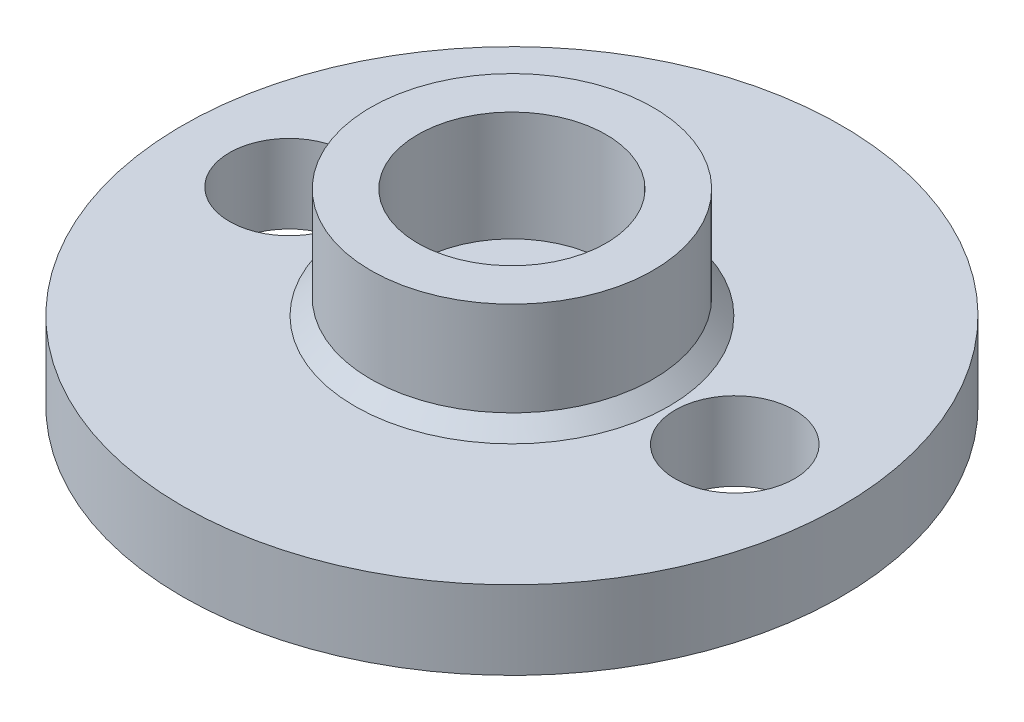
from build123d import *

# Parameters (mm, degrees)
SKETCH1_R               = 10.5
BOSS_EXTRUDE1_DEPTH     = 2.5
SKETCH2_R               = 4.5
SKETCH2_R_2             = 3
BOSS_EXTRUDE2_DEPTH     = 3.5
SKETCH4_R               = 1.5
CUT_EXTRUDE1_DEPTH      = 3.5
CUT_EXTRUDE2_DEPTH      = 16.256146302
CUT_EXTRUDE2_DEPTH_BACK = 16.256146302
SKETCH5_R               = 1.9
CHAMFER1_SIZE           = 0.5


with BuildPart() as part:
    # Sketch1 → Boss-Extrude1 (new body)
    with BuildSketch(Plane(origin=(0, 0, 0), x_dir=(1, 0, 0), z_dir=(0, 1, 0))):
        Circle(SKETCH1_R)
    extrude(amount=BOSS_EXTRUDE1_DEPTH)

    # Sketch2 → Boss-Extrude2 (add)
    with BuildSketch(Plane(origin=(0, 2.5, 0), x_dir=(1, 0, 0), z_dir=(0, 1, 0))):
        Circle(SKETCH2_R)
        Circle(SKETCH2_R_2, mode=Mode.SUBTRACT)
    extrude(amount=BOSS_EXTRUDE2_DEPTH)

    # Sketch4 → Cut-Extrude1 (cut)
    with BuildSketch(Plane(origin=(0, 2.5, 0), x_dir=(1, 0, 0), z_dir=(0, 1, 0))):
        Circle(SKETCH4_R)
    extrude(amount=-CUT_EXTRUDE1_DEPTH, mode=Mode.SUBTRACT)

    # Sketch5 → Cut-Extrude2 (cut, two sides: drawn at the far end of the back side and taken through both)
    with BuildSketch(Plane(origin=(0, 2.5, 0), x_dir=(1, 0, 0), z_dir=(0, 1, 0)).offset(-CUT_EXTRUDE2_DEPTH_BACK)):
        with Locations((-7.1, 0)):
            Circle(SKETCH5_R)
        with Locations((7.1, 0)):
            Circle(SKETCH5_R)
    extrude(amount=CUT_EXTRUDE2_DEPTH + CUT_EXTRUDE2_DEPTH_BACK, mode=Mode.SUBTRACT)

    # Chamfer1
    chamfer1_edges = [part.edges().sort_by_distance(p)[0] for p in [
        (-4.5, 2.5, 0),
    ]]
    chamfer(chamfer1_edges, length=CHAMFER1_SIZE)


solid = part.part
